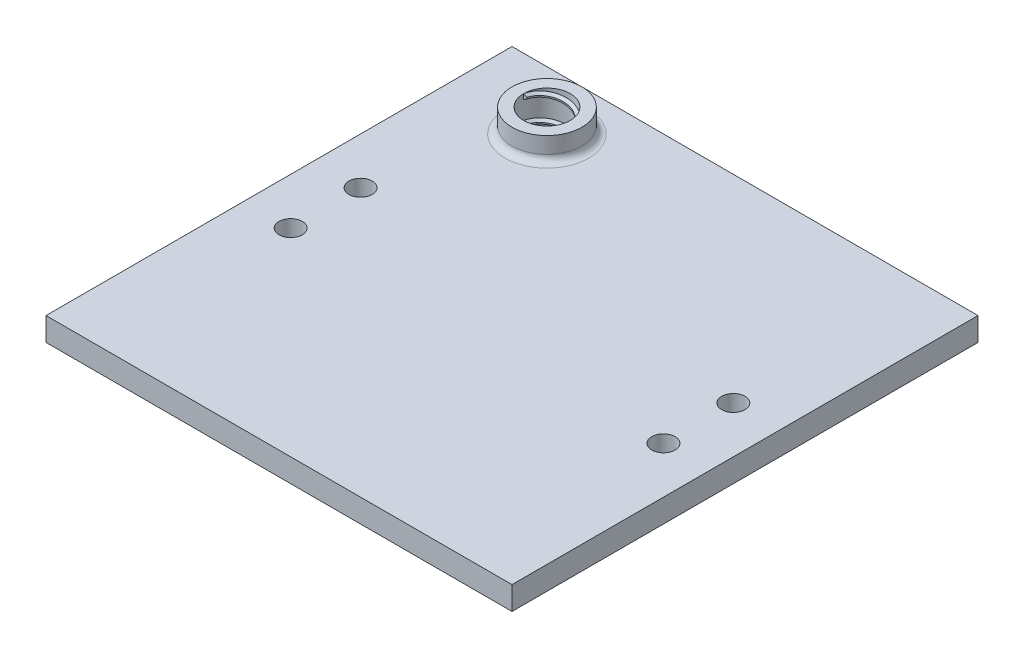
from build123d import *

# Parameters (mm, degrees)
SKETCH1_W                = 200
SKETCH1_H                = 200
BOSS_EXTRUDE1_DEPTH      = 10
CUT_EXTRUDE1_DEPTH       = 142.774468788
CUT_EXTRUDE1_DEPTH_BACK  = 142.774468788
SKETCH2_R                = 5
BOSS_EXTRUDE2_DEPTH      = 20
BOSS_EXTRUDE2_DEPTH_BACK = 10
SKETCH3_R                = 15
SKETCH3_R_2              = 10
FILLET1_R                = 3
CUT_EXTRUDE2_DEPTH       = 143.828568571
CUT_EXTRUDE2_DEPTH_BACK  = 143.828568571
SKETCH8_R                = 10
THREAD1_PITCH            = 10
CUT_EXTRUDE3_DEPTH       = 143.828592839
CUT_EXTRUDE3_DEPTH_BACK  = 143.828592839
SKETCH11_W               = 30
SKETCH11_H               = 5.972577122


with BuildPart() as part:
    # Sketch1 → Boss-Extrude1 (new body)
    with BuildSketch(Plane(origin=(0, 0, 0), x_dir=(1, 0, 0), z_dir=(0, 1, 0))):
        Rectangle(SKETCH1_W, SKETCH1_H)
    extrude(amount=BOSS_EXTRUDE1_DEPTH)

    # Sketch2 → Cut-Extrude1 (cut, two sides: drawn at the far end of the back side and taken through both)
    with BuildSketch(Plane(origin=(0, 0, 0), x_dir=(1, 0, 0), z_dir=(0, 1, 0)).offset(-CUT_EXTRUDE1_DEPTH_BACK)):
        with Locations(Location((-80, 15, 0), (0, 0, 270))):
            Circle(SKETCH2_R)
        with Locations(Location((-80, -15, 0), (0, 0, 270))):
            Circle(SKETCH2_R)
        with Locations(Location((80, 15, 0), (0, 0, 270))):
            Circle(SKETCH2_R)
        with Locations(Location((80, -15, 0), (0, 0, 270))):
            Circle(SKETCH2_R)
    extrude(amount=CUT_EXTRUDE1_DEPTH + CUT_EXTRUDE1_DEPTH_BACK, mode=Mode.SUBTRACT)

    # Sketch3 → Boss-Extrude2 (add, two sides: drawn at the far end of the back side and taken through both)
    with BuildSketch(Plane(origin=(0, 0, 0), x_dir=(1, 0, 0), z_dir=(0, 1, 0)).offset(-BOSS_EXTRUDE2_DEPTH_BACK)):
        with Locations(Location((-60, 75, 0), (0, 0, 270))):
            Circle(SKETCH3_R)
        with Locations(Location((-60, 75, 0), (0, 0, 270))):
            Circle(SKETCH3_R_2, mode=Mode.SUBTRACT)
    extrude(amount=BOSS_EXTRUDE2_DEPTH + BOSS_EXTRUDE2_DEPTH_BACK)

    # Fillet1
    fillet1_edges = [part.edges().sort_by_distance(p)[0] for p in [
        (-60, 10, -90),
        (-60, 0, -90),
    ]]
    fillet(fillet1_edges, radius=FILLET1_R)

    # Sketch8 → Cut-Extrude2 (cut, two sides: drawn at the far end of the back side and taken through both)
    with BuildSketch(Plane(origin=(0, 0, 0), x_dir=(1, 0, 0), z_dir=(0, 1, 0)).offset(-CUT_EXTRUDE2_DEPTH_BACK)):
        with Locations(Location((-60, 75, 0), (0, 0, 270))):
            Circle(SKETCH8_R)
    extrude(amount=CUT_EXTRUDE2_DEPTH + CUT_EXTRUDE2_DEPTH_BACK, mode=Mode.SUBTRACT)

    # Thread1: the profile of Thread Profile1 profile screwed along a right-hand helix of 3 turns, 16 arcs to a turn; built about Z, then put on its axis
    thread1_z = Axis((0, 0, 0), (0, 0, 1))
    thread1_corners = [(10.0003, 0, -0.000173205), (10.0003, 0, 2.187673198), (8.646835313, 0, 1.406249997), (8.646835313, 0, 0.781249997)]
    with BuildLine(mode=Mode.PRIVATE) as thread1_profile:
        Line(thread1_corners[0], thread1_corners[1])
        Line(thread1_corners[1], thread1_corners[2])
        Line(thread1_corners[2], thread1_corners[3])
        Line(thread1_corners[3], thread1_corners[0])
    thread1_cap = Face(thread1_profile.wire())
    thread1_turn_angles = [0, 11.25, 22.5, 33.75, 45, 56.25, 67.5, 78.75, 90, 101.25, 112.5, 123.75, 135, 146.25, 157.5, 168.75, 180, 191.25, 202.5, 213.75, 225, 236.25, 247.5, 258.75, 270, 281.25, 292.5, 303.75, 315, 326.25, 337.5, 348.75, 360]
    thread1_turn_weights = [1, 0.9807852804032304, 1, 0.9807852804032304, 1, 0.9807852804032304, 1, 0.9807852804032304, 1, 0.9807852804032304, 1, 0.9807852804032304, 1, 0.9807852804032304, 1, 0.9807852804032304, 1, 0.9807852804032304, 1, 0.9807852804032304, 1, 0.9807852804032304, 1, 0.9807852804032304, 1, 0.9807852804032304, 1, 0.9807852804032304, 1, 0.9807852804032304, 1, 0.9807852804032304, 1]
    thread1_turn_rails = [Edge.make_bspline([Vector(p[0], p[1], 0).rotate(thread1_z, thread1_turn_angles[k]) / thread1_turn_weights[k] + Vector(0, 0, p[2] + THREAD1_PITCH * thread1_turn_angles[k] / 360) for k in range(33)], [0, 0, 0, 1, 1, 2, 2, 3, 3, 4, 4, 5, 5, 6, 6, 7, 7, 8, 8, 9, 9, 10, 10, 11, 11, 12, 12, 13, 13, 14, 14, 15, 15, 16, 16, 16], 2, thread1_turn_weights) for p in thread1_corners]
    thread1_turn_sides = [Face.make_surface_from_curves(thread1_turn_rails[p[0]], thread1_turn_rails[p[1]]) for p in [(0, 1), (1, 2), (2, 3), (3, 0)]]
    thread1 = Plane(origin=(-60, 20, -75), x_dir=(-1, 0, 0), z_dir=(0, -1, 0)) * Solid(Shell([*[p.moved(Location((0, 0, THREAD1_PITCH * i))) for i in range(3) for p in thread1_turn_sides], thread1_cap, thread1_cap.rotate(thread1_z, 1080).moved(Location((0, 0, THREAD1_PITCH * 1080 / 360)))]))
    add(thread1)

    # Sketch11 → Cut-Extrude3 (cut, two sides: drawn at the far end of the back side and taken through both)
    with BuildSketch(Plane.XY.offset(-CUT_EXTRUDE3_DEPTH_BACK)):
        with Locations((-60, -12.986288561)):
            Rectangle(SKETCH11_W, SKETCH11_H)
    extrude(amount=CUT_EXTRUDE3_DEPTH + CUT_EXTRUDE3_DEPTH_BACK, mode=Mode.SUBTRACT)


solid = part.part
